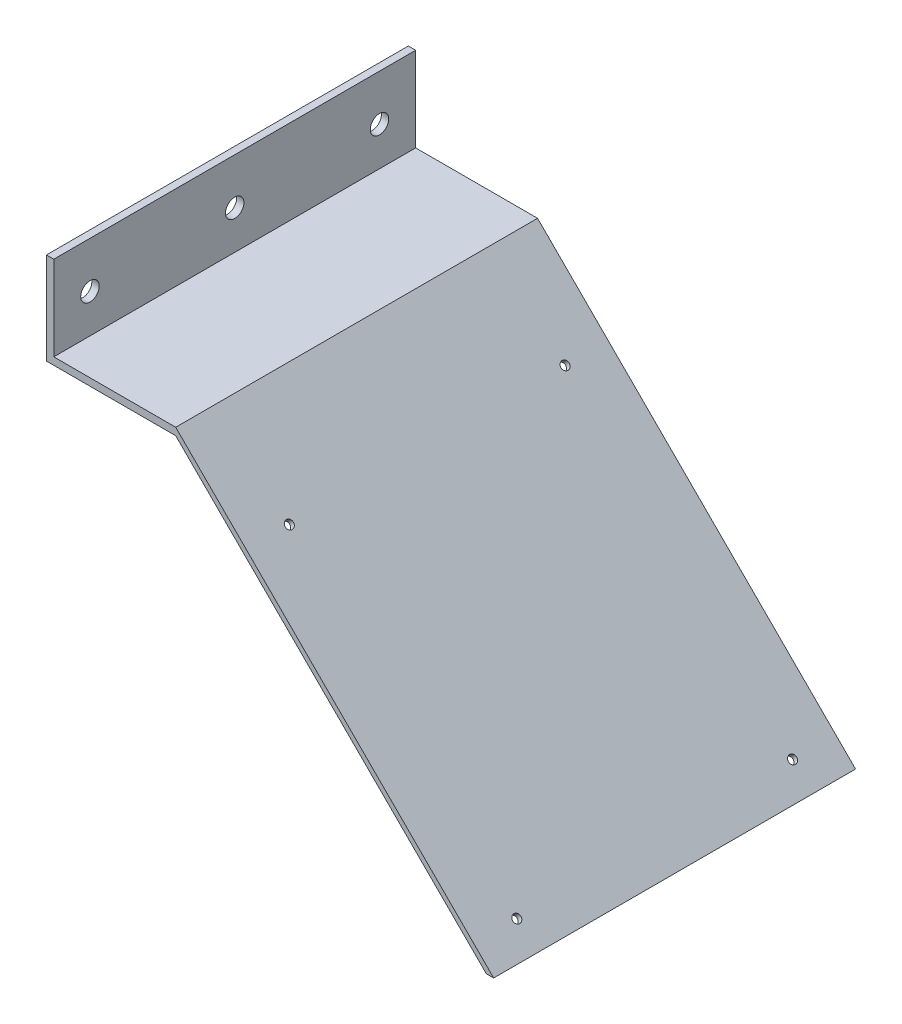
from build123d import *

# Parameters (mm, degrees)
BOSS_EXTRUDE1_DEPTH     = 100
CUT_EXTRUDE1_DEPTH      = 159.384645446
CUT_EXTRUDE1_DEPTH_BACK = 159.384645446
SKETCH2_R               = 1.13
F_4_40_TAPPED_HOLE1_D   = 2.2606
F_1_4_20_TAPPED_HOLE1_D = 5.1054


with BuildPart() as part:
    # Sketch1 → Boss-Extrude1 (new body)
    with BuildSketch(Plane.XY):
        Polygon((87.865570848, -85.833570848), (0, 2.032), (-33.68957, 2.032), (-33.68957, 25.4), (-35.72157, 25.4), (-35.72157, 0), (0, 0), (85.833570848, -85.833570848), align=None)
    extrude(amount=BOSS_EXTRUDE1_DEPTH)

    # Sketch2 → Cut-Extrude1 (cut, two sides: drawn at the far end of the back side and taken through both)
    with BuildSketch(Plane(origin=(1.016, 1.016, 0), x_dir=(0, 0, -1), z_dir=(0.7071067811865448, 0.7071067811865503, 0)).offset(-CUT_EXTRUDE1_DEPTH_BACK)):
        with Locations((-88.1, -26.137000979)):
            Circle(SKETCH2_R)
        with Locations((-11.9, -26.137000979)):
            Circle(SKETCH2_R)
        with Locations((-11.9, -115.037000979)):
            Circle(SKETCH2_R)
        with Locations((-88.1, -115.037000979)):
            Circle(SKETCH2_R)
    extrude(amount=CUT_EXTRUDE1_DEPTH + CUT_EXTRUDE1_DEPTH_BACK, mode=Mode.SUBTRACT)

    # #4-40 Tapped Hole1 (through all)
    with Locations(Plane(origin=(19.497650632, -17.465650632, 88.1), x_dir=(0.707106781187, -0.707106781187, 0), z_dir=(0.707106781187, 0.707106781187, 0))):
        with Locations((1e-09, 0), (1e-09, 76.2), (88.900000001, 76.2), (88.900000001, 0)):
            Hole(F_4_40_TAPPED_HOLE1_D / 2)

    # 1/4-20 Tapped Hole1 (through all)
    with Locations(Plane.ZY.offset(35.72157)):
        with Locations((10, 12.7), (50, 12.7), (90, 12.7)):
            Hole(F_1_4_20_TAPPED_HOLE1_D / 2)


solid = part.part
